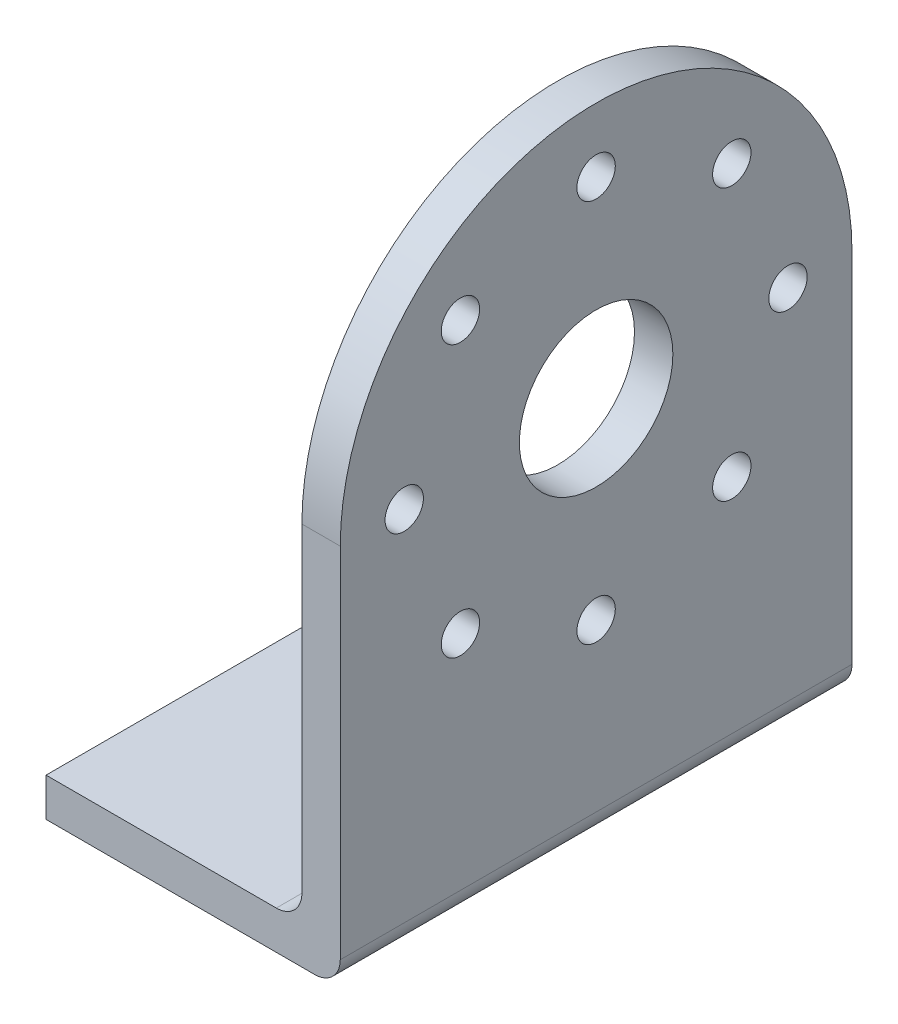
from build123d import *

# Parameters (mm, degrees)
BOSS_EXTRUDE1_OUTLINE_R   = 1.5
BOSS_EXTRUDE1_OUTLINE_R_2 = 6
BOSS_EXTRUDE1_DEPTH       = 3
SKETCH2_W                 = 40
SKETCH2_H                 = 3
BOSS_EXTRUDE2_DEPTH       = 20
FILLET1_R                 = 2
FILLET2_R                 = 2


# Read off the part's stored shape, not the designer's step: Boss-Extrude1
with BuildPart() as part:
    # Boss-Extrude1 outline → Boss-Extrude1 (new body)
    with BuildSketch(Plane(origin=(0, 0, 0), x_dir=(0, 0, -1), z_dir=(1, 0, 0))):
        with BuildLine():
            Line((20, -30), (20, 0))
            ThreePointArc((20, 0), (0, 20), (-20, 0))
            Line((-20, 0), (-20, -30))
            Line((-20, -30), (20, -30))
        make_face()
        with Locations((-10.606601718, -10.606601718)):
            Circle(BOSS_EXTRUDE1_OUTLINE_R, mode=Mode.SUBTRACT)
        with Locations((0, -15)):
            Circle(BOSS_EXTRUDE1_OUTLINE_R, mode=Mode.SUBTRACT)
        with Locations((10.606601718, -10.606601718)):
            Circle(BOSS_EXTRUDE1_OUTLINE_R, mode=Mode.SUBTRACT)
        with Locations((-15, 0)):
            Circle(BOSS_EXTRUDE1_OUTLINE_R, mode=Mode.SUBTRACT)
        with Locations((-10.606601718, 10.606601718)):
            Circle(BOSS_EXTRUDE1_OUTLINE_R, mode=Mode.SUBTRACT)
        Circle(BOSS_EXTRUDE1_OUTLINE_R_2, mode=Mode.SUBTRACT)
        with Locations((15, 0)):
            Circle(BOSS_EXTRUDE1_OUTLINE_R, mode=Mode.SUBTRACT)
        with Locations((0, 15)):
            Circle(BOSS_EXTRUDE1_OUTLINE_R, mode=Mode.SUBTRACT)
        with Locations((10.606601718, 10.606601718)):
            Circle(BOSS_EXTRUDE1_OUTLINE_R, mode=Mode.SUBTRACT)
    extrude(amount=BOSS_EXTRUDE1_DEPTH)

    # Sketch2 → Boss-Extrude2 (add)
    with BuildSketch(Plane.ZY):
        with Locations((0, -28.5)):
            Rectangle(SKETCH2_W, SKETCH2_H)
    extrude(amount=BOSS_EXTRUDE2_DEPTH)

    # Fillet1
    fillet1_edges = [part.edges().sort_by_distance(p)[0] for p in [
        (3, -30, 0),
    ]]
    fillet(fillet1_edges, radius=FILLET1_R)

    # Fillet2
    fillet2_edges = [part.edges().sort_by_distance(p)[0] for p in [
        (0, -27, 0),
    ]]
    fillet(fillet2_edges, radius=FILLET2_R)


solid = part.part
